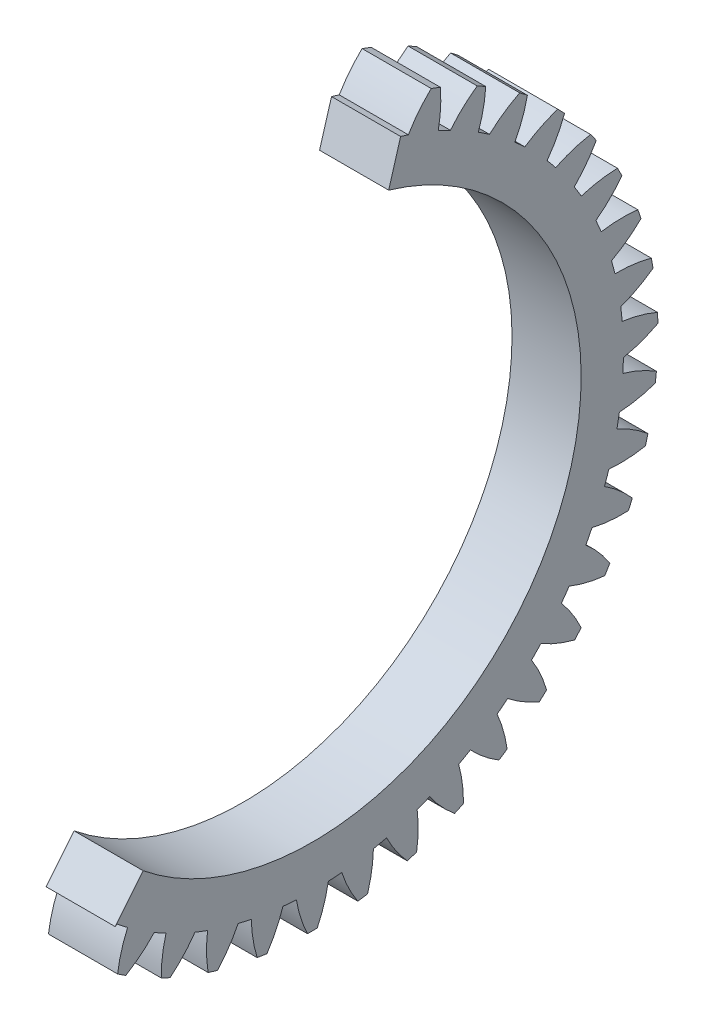
from build123d import *

# Parameters (mm, degrees)
BASPROSKE_W                = 9
BASPROSKE_H                = 45
TOOTHCUT_DEPTH             = 65.272855857
TEETHCUTS_COUNT            = 43
TEETHCUTS_ANGLE            = 351.627906977
BORSKE_R                   = 3
BORE_DEPTH                 = 50.0000508
WYTNIJ_WYCI_GNI_CIE1_DEPTH = 65.265003825


with BuildPart() as part:
    # BasProSke → Base-Revolve (revolve)
    with BuildSketch(Plane(origin=(0, 0, 0), x_dir=(1, 0, 0), z_dir=(0, 1, 0))):
        with Locations((4.5, 22.5)):
            Rectangle(BASPROSKE_W, BASPROSKE_H)
    revolve(axis=Axis((-10, 0, 0), (1, 0, 0)))

    # TooCutSke → ToothCut (cut, through all)
    with BuildSketch(Plane(origin=(0, 0, 0), x_dir=(0, 0, -1), z_dir=(1, 0, 0))):
        with BuildLine():
            ThreePointArc((0.875138877, 40.489543501), (0, 40.499), (-0.875138877, 40.489543501))
            ThreePointArc((-0.875138877, 40.489543501), (-1.611840844, 42.780747503), (-2.66114443, 44.94669015))
            ThreePointArc((-2.66114443, 44.94669015), (0, 45.0254), (2.66114443, 44.94669015))
            ThreePointArc((2.66114443, 44.94669015), (1.611840844, 42.780747503), (0.875138877, 40.489543501))
        make_face()
    toothcut = extrude(amount=TOOTHCUT_DEPTH, mode=Mode.SUBTRACT)

    # TeethCuts: ToothCut ×43 about axis
    teethcuts_axis = Axis((-10, 0, 0), (1, 0, 0))
    for i in range(1, TEETHCUTS_COUNT):
        add(toothcut.rotate(teethcuts_axis, i * TEETHCUTS_ANGLE / (TEETHCUTS_COUNT - 1)), mode=Mode.SUBTRACT)

    # BorSke → Bore (cut, symmetric)
    with BuildSketch(Plane(origin=(0, 0, 0), x_dir=(0, 0, -1), z_dir=(1, 0, 0))):
        Circle(BORSKE_R)
    extrude(amount=BORE_DEPTH, both=True, mode=Mode.SUBTRACT)

    # Szkic2 → Wytnij-wyciągnięcie1 (cut, through all)
    with BuildSketch(Plane(origin=(0, 0, 0), x_dir=(0, 0, -1), z_dir=(1, 0, 0))):
        with BuildLine():
            Line((-31.467717921, -38.8559227), (-22.027402545, -27.19914589))
            ThreePointArc((-22.027402545, -27.19914589), (30.975282492, -16.295148804), (9.936124572, 33.559997445))
            Line((9.936124572, 33.559997445), (14.194463674, 47.942853492))
            ThreePointArc((14.194463674, 47.942853492), (-44.25040356, 23.278784006), (-31.467717921, -38.8559227))
        make_face()
    extrude(amount=WYTNIJ_WYCI_GNI_CIE1_DEPTH, mode=Mode.SUBTRACT)


solid = part.part
